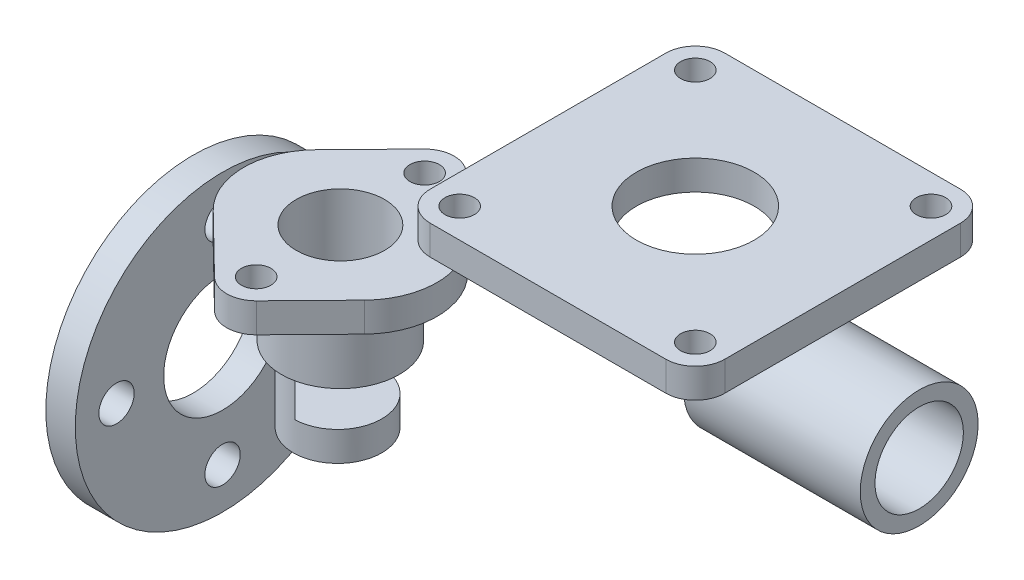
from build123d import *

# Parameters (mm, degrees)
EXTRUDE_1_OUTLINE_W = 50
EXTRUDE_1_OUTLINE_H = 50
EXTRUDE_1_DEPTH     = 5
SKETCH_15_R         = 10
CUT_EXTRUDE_1_DEPTH = 8
FILLET_1_R          = 5
SKETCH_16_R         = 2.5
CUT_EXTRUDE_2_DEPTH = 8
SKETCH_17_R         = 25
SKETCH_17_R_2       = 3
EXTRUDE_2_DEPTH     = 5
SKETCH_18_R         = 10
CUT_EXTRUDE_3_DEPTH = 8
EXTRUDE_START       = -2
SKETCH_19_R         = 10
EXTRUDE_3_DEPTH     = 12
EXTRUDE_START_2     = 2
SKETCH_20_R         = 10
EXTRUDE_4_DEPTH     = 30
SKETCH_21_R         = 7.5
CUT_EXTRUDE_4_DEPTH = 35
SKETCH_22_R         = 7.5
CUT_EXTRUDE_5_DEPTH = 25
SKETCH_23_R         = 2.5
EXTRUDE_5_DEPTH     = 5
SKETCH_24_R         = 7.5
EXTRUDE_6_DEPTH     = 30
SKETCH_27_R         = 7.5
CUT_EXTRUDE_6_DEPTH = 25


# Read off the part's stored shape, not the designer's step: 보스-돌출1
with BuildPart() as part:
    # 보스-돌출1 outline → 보스-돌출1 (new body)
    with BuildSketch(Plane(origin=(0, 47.88103287, 0), x_dir=(1, 0, 0), z_dir=(0, 1, 0))):
        with Locations((27.244520639, 0)):
            Rectangle(EXTRUDE_1_OUTLINE_W, EXTRUDE_1_OUTLINE_H)
    extrude(amount=EXTRUDE_1_DEPTH)

    # 스케치15 → 컷-돌출1 (cut)
    with BuildSketch(Plane(origin=(0, 52.88103287, 0), x_dir=(1, 0, 0), z_dir=(0, 1, 0))):
        with Locations(Location((27.244520639, 0, 0), (0, 0, 270))):
            Circle(SKETCH_15_R)
    extrude(amount=-CUT_EXTRUDE_1_DEPTH, mode=Mode.SUBTRACT)

    # 필렛1
    fillet_1_edges = [part.edges().sort_by_distance(p)[0] for p in [
        (52.244520639, 50.38103287, 25),
        (2.244520639, 50.38103287, 25),
        (2.244520639, 50.38103287, -25),
        (52.244520639, 50.38103287, -25),
    ]]
    fillet(fillet_1_edges, radius=FILLET_1_R)

    # 스케치16 → 컷-돌출2 (cut)
    with BuildSketch(Plane(origin=(0, 52.88103287, 0), x_dir=(1, 0, 0), z_dir=(0, 1, 0))):
        with Locations(Location((7.244520639, 20, 0), (0, 0, 270))):
            Circle(SKETCH_16_R)
        with Locations(Location((7.244520639, -20, 0), (0, 0, 270))):
            Circle(SKETCH_16_R)
        with Locations(Location((47.244520639, -20, 0), (0, 0, 270))):
            Circle(SKETCH_16_R)
        with Locations(Location((47.244520639, 20, 0), (0, 0, 270))):
            Circle(SKETCH_16_R)
    extrude(amount=-CUT_EXTRUDE_2_DEPTH, mode=Mode.SUBTRACT)


with BuildPart() as body_2:
    # 스케치17 → 보스-돌출2 (new body)
    with BuildSketch(Plane(origin=(-58, 0, 0), x_dir=(0, 0, -1), z_dir=(1, 0, 0))):
        with Locations((0, -7.232514397)):
            Circle(SKETCH_17_R)
        with Locations((0, 10.767485603)):
            Circle(SKETCH_17_R_2, mode=Mode.SUBTRACT)
        with Locations((-18, -7.232514397)):
            Circle(SKETCH_17_R_2, mode=Mode.SUBTRACT)
        with Locations((18, -7.232514397)):
            Circle(SKETCH_17_R_2, mode=Mode.SUBTRACT)
        with Locations((0, -25.232514397)):
            Circle(SKETCH_17_R_2, mode=Mode.SUBTRACT)
    extrude(amount=EXTRUDE_2_DEPTH)

    # 스케치18 → 컷-돌출3 (cut)
    with BuildSketch(Plane(origin=(-58, 0, 0), x_dir=(0, 0, -1), z_dir=(1, 0, 0))):
        with Locations((0, -7.232514397)):
            Circle(SKETCH_18_R)
    extrude(amount=CUT_EXTRUDE_3_DEPTH, mode=Mode.SUBTRACT)


with BuildPart() as body_3:
    # 스케치19 → 보스-돌출3 (new body)
    with BuildSketch(Plane(origin=(0, 5, 0), x_dir=(1, 0, 0), z_dir=(0, 1, 0)).offset(EXTRUDE_START)):
        with Locations(Location((-33, 0, 0), (0, 0, 270))):
            Circle(SKETCH_19_R)
    extrude(amount=EXTRUDE_3_DEPTH)

    # 스케치22 → 컷-돌출5 (cut)
    with BuildSketch(Plane(origin=(0, 15, 0), x_dir=(1, 0, 0), z_dir=(0, 1, 0))):
        with Locations(Location((-33, 0, 0), (0, 0, 270))):
            Circle(SKETCH_22_R)
    extrude(amount=-CUT_EXTRUDE_5_DEPTH, mode=Mode.SUBTRACT)

    # 스케치23 → 보스-돌출5 (add)
    with BuildSketch(Plane(origin=(0, 15, 0), x_dir=(1, 0, 0), z_dir=(0, 1, 0))):
        with BuildLine():
            Line((-29.977373614, 18.346097633), (-20.087613409, 8.67389473))
            ThreePointArc((-20.087613409, 8.67389473), (-16.328380033, -0.123678532), (-19.891024332, -9.002681656))
            Line((-19.891024332, -9.002681656), (-28.951995832, -18.267462002))
            ThreePointArc((-28.951995832, -18.267462002), (-32.471025137, -19.771155352), (-36.022626386, -18.346097633))
            Line((-36.022626386, -18.346097633), (-45.912386591, -8.67389473))
            ThreePointArc((-45.912386591, -8.67389473), (-49.671619967, 0.123678532), (-46.108975668, 9.002681656))
            Line((-46.108975668, 9.002681656), (-37.048004168, 18.267462002))
            ThreePointArc((-37.048004168, 18.267462002), (-33.528974863, 19.771155352), (-29.977373614, 18.346097633))
        make_face()
        with Locations(Location((-33.473371076, 14.77146454, 0), (0, 0, 270))):
            Circle(SKETCH_23_R, mode=Mode.SUBTRACT)
        with Locations(Location((-32.526628924, -14.77146454, 0), (0, 0, 270))):
            Circle(SKETCH_23_R, mode=Mode.SUBTRACT)
    extrude(amount=EXTRUDE_5_DEPTH)

    # 스케치24 → 보스-돌출6 (add)
    with BuildSketch(Plane(origin=(0, 20, 0), x_dir=(1, 0, 0), z_dir=(0, 1, 0))):
        with Locations(Location((-33.473371076, 0, 0), (0, 0, 270))):
            Circle(SKETCH_24_R)
    extrude(amount=-EXTRUDE_6_DEPTH)

    # 스케치27 → 컷-돌출6 (cut)
    with BuildSketch(Plane(origin=(0, 20, 0), x_dir=(1, 0, 0), z_dir=(0, 1, 0))):
        with Locations(Location((-33, 0, 0), (0, 0, 270))):
            Circle(SKETCH_27_R)
    extrude(amount=-CUT_EXTRUDE_6_DEPTH, mode=Mode.SUBTRACT)


with BuildPart() as body_4:
    # 스케치20 → 보스-돌출4 (new body)
    with BuildSketch(Plane.ZY.offset(-37.244520639).offset(EXTRUDE_START_2)):
        with Locations((0, 34.88103287)):
            Circle(SKETCH_20_R)
    extrude(amount=-EXTRUDE_4_DEPTH)

    # 스케치21 → 컷-돌출4 (cut)
    with BuildSketch(Plane(origin=(65.244520639, 0, 0), x_dir=(0, 0, -1), z_dir=(1, 0, 0))):
        with Locations((0, 34.88103287)):
            Circle(SKETCH_21_R)
    extrude(amount=-CUT_EXTRUDE_4_DEPTH, mode=Mode.SUBTRACT)


solid = Compound([part.part, body_2.part, body_3.part, body_4.part])
